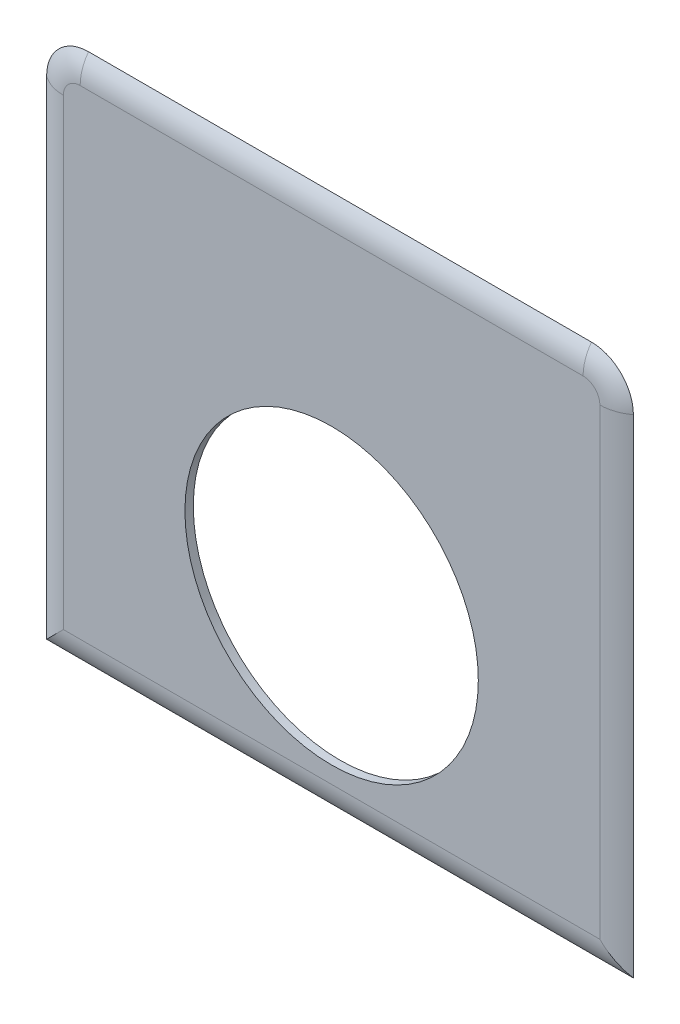
from build123d import *

# Parameters (mm, degrees)
SKETCH1_W           = 177.8
SKETCH1_H           = 160.528
SKETCH1_R           = 44.45
BOSS_EXTRUDE1_DEPTH = 2.54
FILLET1_R           = 12.7
FILLET2_R           = 12.7


with BuildPart() as part:
    # Sketch1 → Boss-Extrude1 (new body)
    with BuildSketch(Plane.XY):
        with Locations((88.9, 80.264)):
            Rectangle(SKETCH1_W, SKETCH1_H)
        with Locations((88.9, 57.15)):
            Circle(SKETCH1_R, mode=Mode.SUBTRACT)
    extrude(amount=BOSS_EXTRUDE1_DEPTH)

    # Fillet1
    fillet1_edges = [part.edges().sort_by_distance(p)[0] for p in [
        (0, 160.528, 1.27),
        (177.8, 160.528, 1.27),
    ]]
    fillet(fillet1_edges, radius=FILLET1_R)

    # Fillet2
    # the kernel refuses this fillet: 12.7 mm, written as the material it takes off along each edge
    with BuildSketch(Plane(origin=(177.8, -19.05, 2.54), x_dir=(0, 0, -1), z_dir=(0, 1, 0))) as fillet2_piece_1:
        with BuildLine():
            CenterArc((12.7, 7.62), FILLET2_R, 180, 36.869897646)
            Line((0, 7.62), (-0.254, 7.62))
            Line((-0.254, 7.62), (-0.254, 0))
            Line((-0.254, 0), (0, -0.254))
            ThreePointArc((0, -0.254), (1.27, -0.254), (2.3368, -0.1524))
            Line((2.3368, -0.1524), (2.54, 0))
        make_face()
    extrude(amount=166.878, mode=Mode.SUBTRACT)
    with BuildSketch(Plane(origin=(165.1, 147.828, 2.54), x_dir=(1, 0, 0), z_dir=(0, -1, 0))) as fillet2_piece_2:
        with BuildLine():
            CenterArc((5.08, -12.7), FILLET2_R, 53.130102354, 36.869897646)
            Line((5.08, 0), (5.08, 0.254))
            Line((5.08, 0.254), (12.7, 0.254))
            Line((12.7, 0.254), (12.954, 0))
            ThreePointArc((12.954, 0), (12.954, -1.27), (12.8524, -2.3368))
            Line((12.8524, -2.3368), (12.7, -2.54))
        make_face()
    revolve(axis=Axis((165.1, 147.828, 2.54), (0, 0, 1)), revolution_arc=90, mode=Mode.SUBTRACT)
    with BuildSketch(Plane(origin=(165.1, 160.528, 2.54), x_dir=(0, -1, 0), z_dir=(-1, 0, 0))) as fillet2_piece_3:
        with BuildLine():
            CenterArc((7.62, -12.7), FILLET2_R, 90, 36.869897646)
            Line((0, -2.54), (-0.1524, -2.3368))
            ThreePointArc((-0.1524, -2.3368), (-0.254, -1.27), (-0.254, 0))
            Line((-0.254, 0), (0, 0.254))
            Line((0, 0.254), (7.62, 0.254))
            Line((7.62, 0.254), (7.62, 0))
        make_face()
    extrude(amount=152.4, mode=Mode.SUBTRACT)
    with BuildSketch(Plane(origin=(12.7, 147.828, 2.54), x_dir=(0, 1, 0), z_dir=(1, 0, 0))) as fillet2_piece_4:
        with BuildLine():
            CenterArc((5.08, -12.7), FILLET2_R, 53.130102354, 36.869897646)
            Line((12.7, -2.54), (12.8524, -2.3368))
            ThreePointArc((12.8524, -2.3368), (12.954, -1.27), (12.954, 0))
            Line((12.954, 0), (12.7, 0.254))
            Line((12.7, 0.254), (5.08, 0.254))
            Line((5.08, 0.254), (5.08, 0))
        make_face()
    revolve(axis=Axis((12.7, 147.828, 2.54), (0, 0, 1)), revolution_arc=90, mode=Mode.SUBTRACT)
    with BuildSketch(Plane(origin=(0, 147.828, 2.54), x_dir=(1, 0, 0), z_dir=(0, -1, 0))) as fillet2_piece_5:
        with BuildLine():
            CenterArc((7.62, -12.7), FILLET2_R, 90, 36.869897646)
            Line((0, -2.54), (-0.1524, -2.3368))
            ThreePointArc((-0.1524, -2.3368), (-0.254, -1.27), (-0.254, 0))
            Line((-0.254, 0), (0, 0.254))
            Line((0, 0.254), (7.62, 0.254))
            Line((7.62, 0.254), (7.62, 0))
        make_face()
    extrude(amount=166.878, mode=Mode.SUBTRACT)
    with BuildSketch(Plane(origin=(-19.05, 0, 2.54), x_dir=(0, 0, -1), z_dir=(1, 0, 0))) as fillet2_piece_6:
        with BuildLine():
            CenterArc((12.7, 7.62), FILLET2_R, 180, 36.869897646)
            Line((0, 7.62), (-0.254, 7.62))
            Line((-0.254, 7.62), (-0.254, 0))
            Line((-0.254, 0), (0, -0.254))
            ThreePointArc((0, -0.254), (1.27, -0.254), (2.3368, -0.1524))
            Line((2.3368, -0.1524), (2.54, 0))
        make_face()
    extrude(amount=215.9, mode=Mode.SUBTRACT)


solid = part.part
